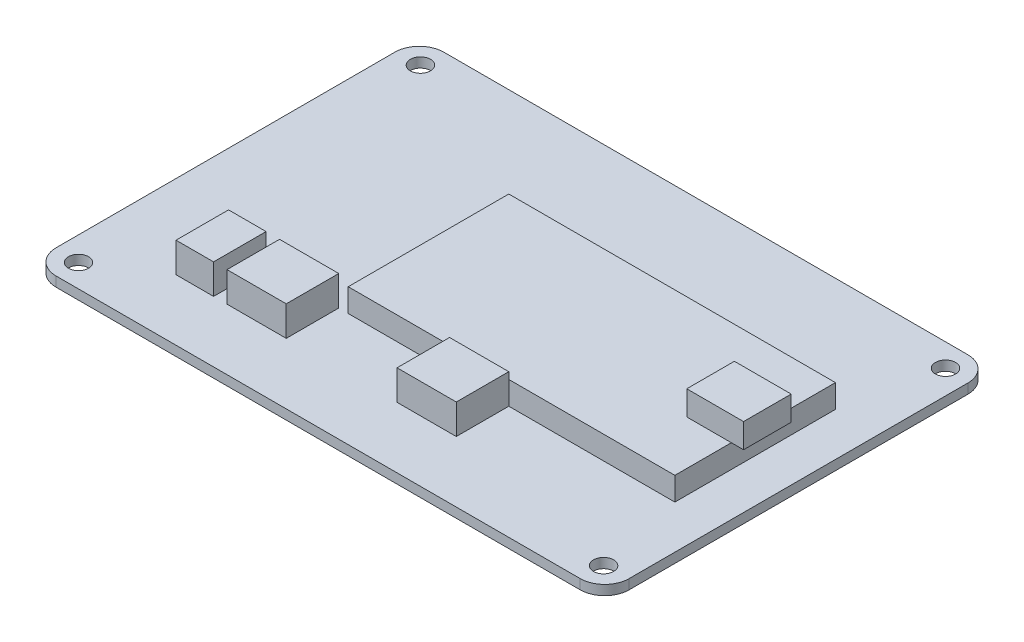
from build123d import *

# Parameters (mm, degrees)
SKETCH1_W           = 93.85
SKETCH1_H           = 63.5
SKETCH1_R           = 1.65
BOSS_EXTRUDE1_DEPTH = 1.6
FILLET1_R           = 4
SKETCH2_W           = 53.5
SKETCH2_H           = 26.3
BOSS_EXTRUDE2_DEPTH = 3.8
SKETCH3_W           = 9.3
SKETCH3_H           = 7.8
BOSS_EXTRUDE3_DEPTH = 4
SKETCH4_W           = 9.7
SKETCH4_H           = 8.6
SKETCH4_W_2         = 6.151959396
BOSS_EXTRUDE4_DEPTH = 4.9


with BuildPart() as part:
    # Sketch1 → Boss-Extrude1 (new body)
    with BuildSketch(Plane(origin=(0, 0, 0), x_dir=(1, 0, 0), z_dir=(0, 1, 0))):
        Rectangle(SKETCH1_W, SKETCH1_H)
        with Locations((-43, 28)):
            Circle(SKETCH1_R, mode=Mode.SUBTRACT)
        with Locations((43, 28)):
            Circle(SKETCH1_R, mode=Mode.SUBTRACT)
        with Locations((43, -28)):
            Circle(SKETCH1_R, mode=Mode.SUBTRACT)
        with Locations((-43, -28)):
            Circle(SKETCH1_R, mode=Mode.SUBTRACT)
    extrude(amount=BOSS_EXTRUDE1_DEPTH)

    # Fillet1
    fillet1_edges = [part.edges().sort_by_distance(p)[0] for p in [
        (-46.925, 0.8, -31.75),
        (46.925, 0.8, -31.75),
        (46.925, 0.8, 31.75),
        (-46.925, 0.8, 31.75),
    ]]
    fillet(fillet1_edges, radius=FILLET1_R)

    # Sketch2 → Boss-Extrude2 (add)
    with BuildSketch(Plane(origin=(0, 1.6, 0), x_dir=(1, 0, 0), z_dir=(0, 1, 0))):
        with Locations((13.075, 0)):
            Rectangle(SKETCH2_W, SKETCH2_H)
    extrude(amount=BOSS_EXTRUDE2_DEPTH)

    # Sketch3 → Boss-Extrude3 (add)
    with BuildSketch(Plane(origin=(0, 5.4, 0), x_dir=(1, 0, 0), z_dir=(0, 1, 0))):
        with Locations((37.175, 0)):
            Rectangle(SKETCH3_W, SKETCH3_H)
    extrude(amount=BOSS_EXTRUDE3_DEPTH)

    # Sketch4 → Boss-Extrude4 (add)
    with BuildSketch(Plane(origin=(0, 1.6, 0), x_dir=(1, 0, 0), z_dir=(0, 1, 0))):
        with Locations((7.775, -17.45)):
            Rectangle(SKETCH4_W, SKETCH4_H)
        with Locations((-20.075, -17.45)):
            Rectangle(SKETCH4_W, SKETCH4_H)
        with Locations((-30.200979698, -17.45)):
            Rectangle(SKETCH4_W_2, SKETCH4_H)
    extrude(amount=BOSS_EXTRUDE4_DEPTH)


solid = part.part
